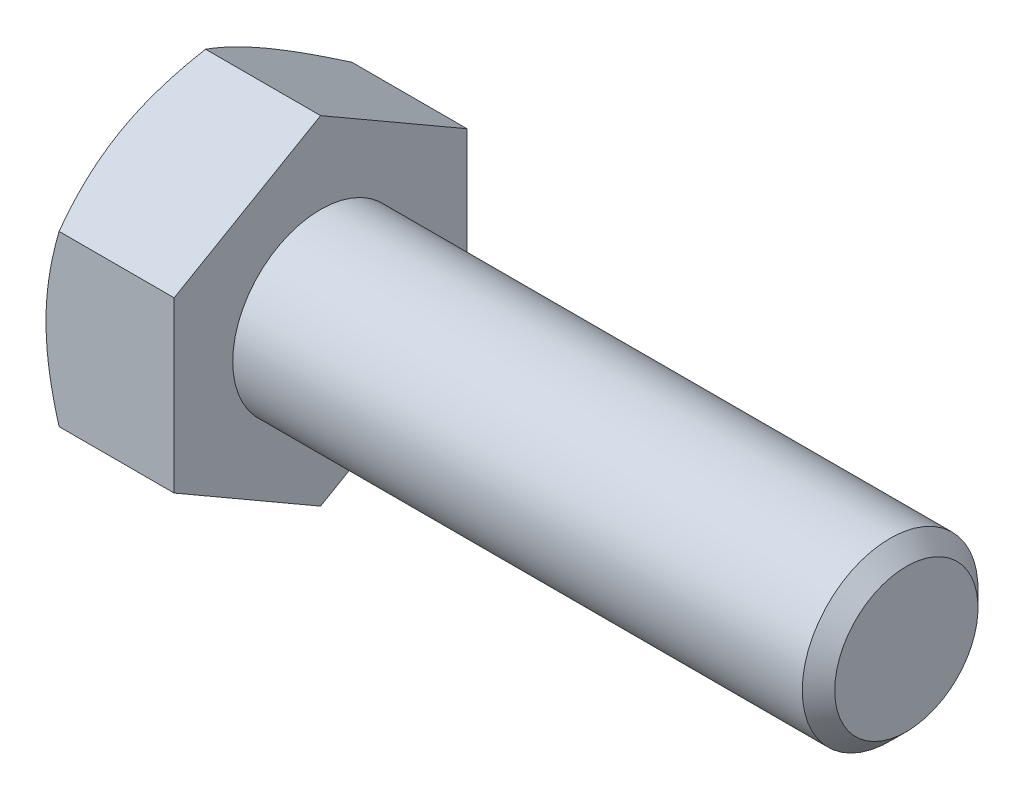
from build123d import *

# Parameters (mm, degrees)
BASEHEAD_DEPTH = 4.375


# Read off the part's stored shape, not the designer's step: HeadChamfer
with BuildPart() as part:
    # Sketch1 → BaseHead (new body)
    with BuildSketch(Plane(origin=(0, 0, 0), x_dir=(0, 0, -1), z_dir=(1, 0, 0))):
        Polygon((5, 2.886751346), (5, -2.886751346), (0, -5.773502692), (-5, -2.886751346), (-5, 2.886751346), (0, 5.773502692), align=None)
    extrude(amount=BASEHEAD_DEPTH)

    # HeadChamfer outline → HeadChamfer (revolve, cut)
    with BuildSketch(Plane.YX):
        Polygon((5.773502688, 0.446581985), (4.999998827, -6.77e-07), (5.773502692, -8.45e-07), align=None)
    revolve(axis=Axis((0, 0, 0), (1, 0, 0)), mode=Mode.SUBTRACT)

    # HeadChamfer 2 outline → HeadChamfer 2 (revolve)
    with BuildSketch(Plane.YX):
        Polygon((3, 4.375), (3, 23.8205), (2.4455, 24.375), (0, 24.375), (0, 4.375), align=None)
    revolve(axis=Axis((0, 0, 0), (1, 0, 0)))


solid = part.part
